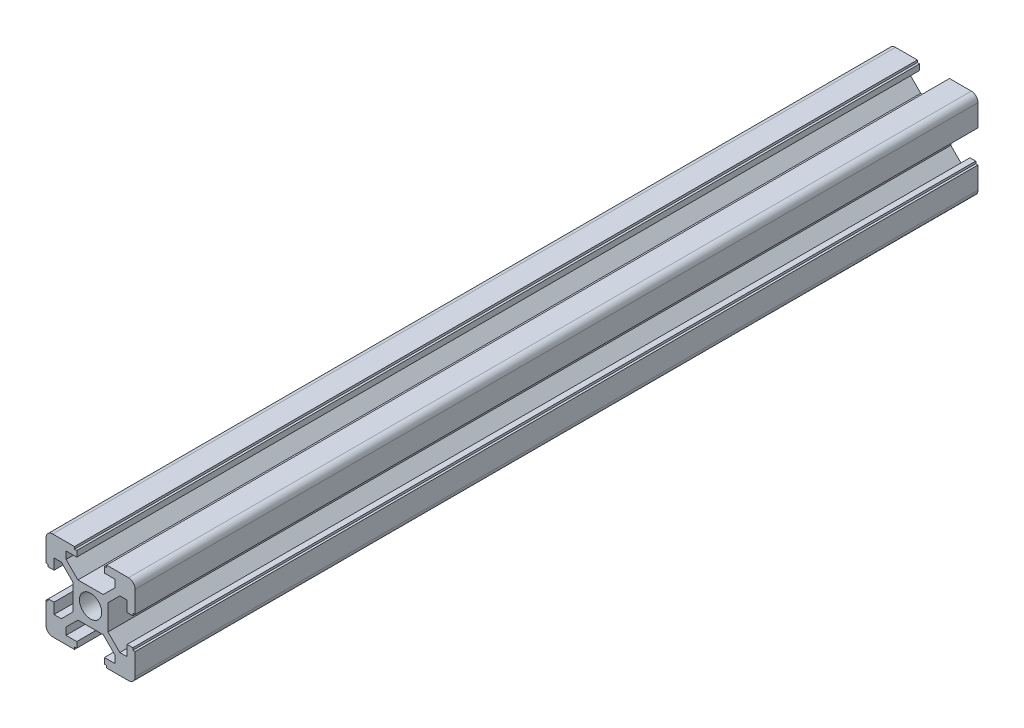
from build123d import *

# Parameters (mm, degrees)
SKETCH1_R           = 2.5
BOSS_EXTRUDE1_DEPTH = 189.096108091
SCALE_2_SCALE       = 3
SCALE_3_SCALE       = 6
SCALE_5_SCALE       = 2
SCALE_6_SCALE       = 0.25
SCALE_7_SCALE       = 0.125
SCALE_8_SCALE       = 0.25
SCALE_9_SCALE       = 4
SCALE_10_SCALE      = 4
OTHER_START         = -17.55
OTHER_1_OUTLINE_R   = 5
OTHER_1_DEPTH       = 10


# Read off the part's stored shape, not the designer's step: 孔1
with BuildPart() as part:
    # Sketch1 → Boss-Extrude1 (new body)
    with BuildSketch(Plane.XY):
        with BuildLine():
            Line((2.839339828, 3.9), (5.5, 6.560660172))
            Line((5.5, 6.560660172), (5.5, 8.2))
            Line((5.5, 8.2), (3.1, 8.2))
            Line((3.1, 8.2), (3.1, 9.5))
            Line((3.1, 9.5), (3.6, 9.5))
            Line((3.6, 9.5), (3.6, 10))
            Line((3.6, 10), (8.5, 10))
            ThreePointArc((8.5, 10), (9.560660172, 9.560660172), (10, 8.5))
            Line((10, 8.5), (10, 3.6))
            Line((10, 3.6), (9.5, 3.6))
            Line((9.5, 3.6), (9.5, 3.1))
            Line((9.5, 3.1), (8.2, 3.1))
            Line((8.2, 3.1), (8.2, 5.5))
            Line((8.2, 5.5), (6.560660172, 5.5))
            Line((6.560660172, 5.5), (3.9, 2.839339828))
            Line((3.9, 2.839339828), (3.9, -2.839339828))
            Line((3.9, -2.839339828), (6.560660172, -5.5))
            Line((6.560660172, -5.5), (8.2, -5.5))
            Line((8.2, -5.5), (8.2, -3.1))
            Line((8.2, -3.1), (9.5, -3.1))
            Line((9.5, -3.1), (9.5, -3.6))
            Line((9.5, -3.6), (10, -3.6))
            Line((10, -3.6), (10, -8.5))
            ThreePointArc((10, -8.5), (9.560660172, -9.560660172), (8.5, -10))
            Line((8.5, -10), (3.6, -10))
            Line((3.6, -10), (3.6, -9.5))
            Line((3.6, -9.5), (3.1, -9.5))
            Line((3.1, -9.5), (3.1, -8.2))
            Line((3.1, -8.2), (5.5, -8.2))
            Line((5.5, -8.2), (5.5, -6.560660172))
            Line((5.5, -6.560660172), (2.839339828, -3.9))
            Line((2.839339828, -3.9), (-2.839339828, -3.9))
            Line((-2.839339828, -3.9), (-5.5, -6.560660172))
            Line((-5.5, -6.560660172), (-5.5, -8.2))
            Line((-5.5, -8.2), (-3.1, -8.2))
            Line((-3.1, -8.2), (-3.1, -9.5))
            Line((-3.1, -9.5), (-3.6, -9.5))
            Line((-3.6, -9.5), (-3.6, -10))
            Line((-3.6, -10), (-8.5, -10))
            ThreePointArc((-8.5, -10), (-9.560660172, -9.560660172), (-10, -8.5))
            Line((-10, -8.5), (-10, -3.6))
            Line((-10, -3.6), (-9.5, -3.6))
            Line((-9.5, -3.6), (-9.5, -3.1))
            Line((-9.5, -3.1), (-8.2, -3.1))
            Line((-8.2, -3.1), (-8.2, -5.5))
            Line((-8.2, -5.5), (-6.560660172, -5.5))
            Line((-6.560660172, -5.5), (-3.9, -2.839339828))
            Line((-3.9, -2.839339828), (-3.9, 2.839339828))
            Line((-3.9, 2.839339828), (-6.560660172, 5.5))
            Line((-6.560660172, 5.5), (-8.2, 5.5))
            Line((-8.2, 5.5), (-8.2, 3.1))
            Line((-8.2, 3.1), (-9.5, 3.1))
            Line((-9.5, 3.1), (-9.5, 3.6))
            Line((-9.5, 3.6), (-10, 3.6))
            Line((-10, 3.6), (-10, 8.5))
            ThreePointArc((-10, 8.5), (-9.560660172, 9.560660172), (-8.5, 10))
            Line((-8.5, 10), (-3.6, 10))
            Line((-3.6, 10), (-3.6, 9.5))
            Line((-3.6, 9.5), (-3.1, 9.5))
            Line((-3.1, 9.5), (-3.1, 8.2))
            Line((-3.1, 8.2), (-5.5, 8.2))
            Line((-5.5, 8.2), (-5.5, 6.560660172))
            Line((-5.5, 6.560660172), (-2.839339828, 3.9))
            Line((-2.839339828, 3.9), (2.839339828, 3.9))
        make_face()
        with Locations((0, 0.235847297)):
            Circle(SKETCH1_R, mode=Mode.SUBTRACT)
    extrude(amount=BOSS_EXTRUDE1_DEPTH)


with BuildPart() as part_1:
    # 缩放比例2: scaled about (0, -0.027095247, 94.548054046)
    add(part.part.scale(SCALE_2_SCALE).moved(Location((0, 0.054190494, -189.096108092))))


with BuildPart() as part_2:
    # 缩放比例3: scaled about (0, -0.027095247, 94.548054045)
    add(part_1.part.scale(SCALE_3_SCALE).moved(Location((0, 0.135476235, -472.740270225))))


with BuildPart() as part_3:
    # 缩放比例5: scaled about (0, -0.027095249, 94.548054043)
    add(part_2.part.scale(SCALE_5_SCALE).moved(Location((0, 0.027095249, -94.548054043))))


with BuildPart() as part_4:
    # 缩放比例6: scaled about (0, -0.027095249, 94.548054044)
    add(part_3.part.scale(SCALE_6_SCALE).moved(Location((0, -0.020321437, 70.911040533))))


with BuildPart() as part_5:
    # 缩放比例7: scaled about (0, -0.027095249, 94.548054044)
    add(part_4.part.scale(SCALE_7_SCALE).moved(Location((0, -0.023708343, 82.729547289))))


with BuildPart() as part_6:
    # 缩放比例8: scaled about (0, -0.027095249, 94.548054044)
    add(part_5.part.scale(SCALE_8_SCALE).moved(Location((0, -0.020321437, 70.911040533))))


with BuildPart() as part_7:
    # 缩放比例9: scaled about (0, -0.027095249, 94.548054044)
    add(part_6.part.scale(SCALE_9_SCALE).moved(Location((0, 0.081285747, -283.644162132))))


with BuildPart() as part_8:
    # 缩放比例10: scaled about (0, -0.027095249, 94.548054044)
    add(part_7.part.scale(SCALE_10_SCALE).moved(Location((0, 0.081285747, -283.644162132))))

    # 孔1 outline → 孔1 (cut)
    with BuildSketch(Plane.YZ.offset(OTHER_START)):
        with Locations((7.344833538, 1.297306883)):
            Circle(OTHER_1_OUTLINE_R)
    extrude(amount=OTHER_1_DEPTH, mode=Mode.SUBTRACT)


solid = part_8.part
